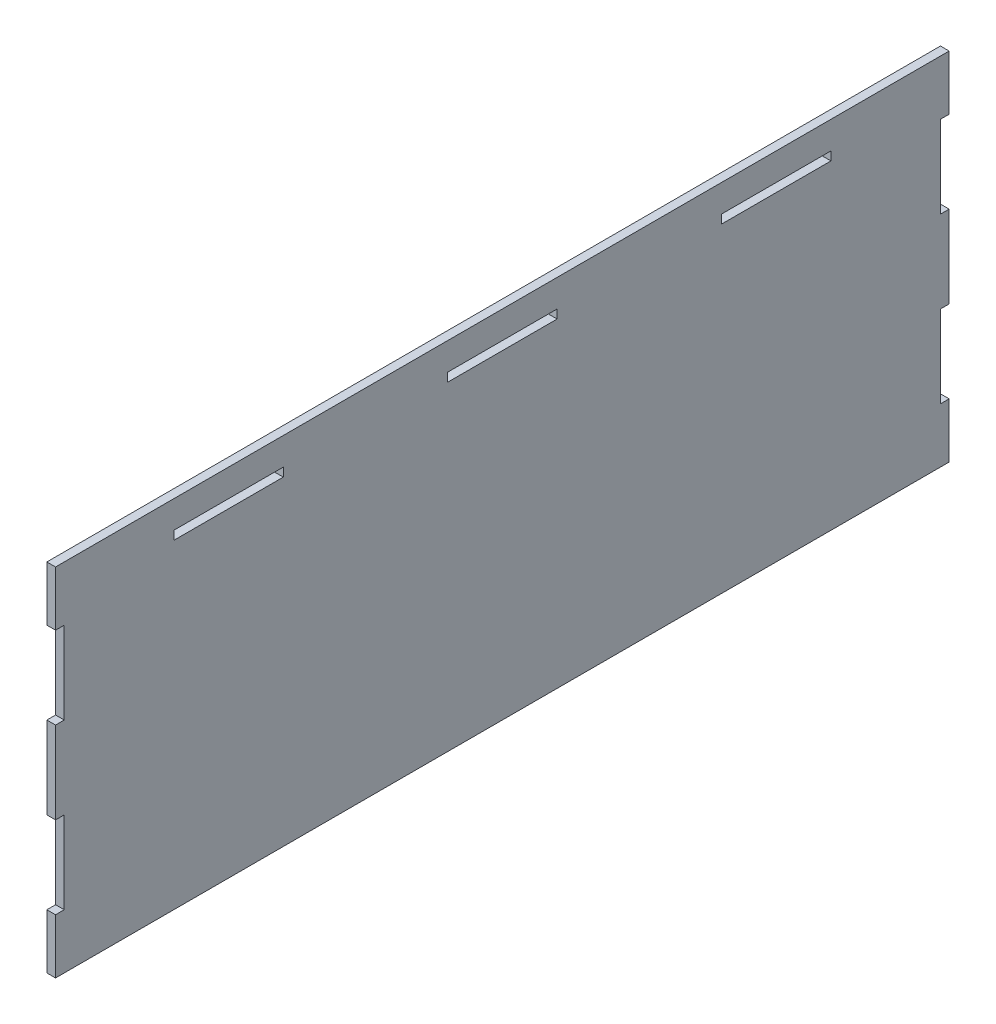
from build123d import *

# Parameters (mm, degrees)
SKETCH1_W           = 326.35
SKETCH1_H           = 130
BOSS_EXTRUDE1_DEPTH = 3.175
SKETCH2_W           = 40
SKETCH2_H           = 3.175
SKETCH2_W_2         = 3.175
SKETCH2_H_2         = 30
CUT_EXTRUDE1_DEPTH  = 10


with BuildPart() as part:
    # Sketch1 → Boss-Extrude1 (new body)
    with BuildSketch(Plane(origin=(0, 0, 0), x_dir=(0, 0, -1), z_dir=(1, 0, 0))):
        with Locations((163.175, -65)):
            Rectangle(SKETCH1_W, SKETCH1_H)
    extrude(amount=BOSS_EXTRUDE1_DEPTH)

    # Sketch2 → Cut-Extrude1 (cut)
    with BuildSketch(Plane(origin=(3.175, 0, 0), x_dir=(0, 0, -1), z_dir=(1, 0, 0))):
        with Locations((63.175, -11.5875)):
            Rectangle(SKETCH2_W, SKETCH2_H)
        with Locations((163.175, -11.5875)):
            Rectangle(SKETCH2_W, SKETCH2_H)
        with Locations((263.175, -11.5875)):
            Rectangle(SKETCH2_W, SKETCH2_H)
        with Locations((324.7625, -35)):
            Rectangle(SKETCH2_W_2, SKETCH2_H_2)
        with Locations((324.7625, -95)):
            Rectangle(SKETCH2_W_2, SKETCH2_H_2)
        with Locations((1.5875, -35)):
            Rectangle(SKETCH2_W_2, SKETCH2_H_2)
        with Locations((1.5875, -95)):
            Rectangle(SKETCH2_W_2, SKETCH2_H_2)
    extrude(amount=-CUT_EXTRUDE1_DEPTH, mode=Mode.SUBTRACT)


solid = part.part
